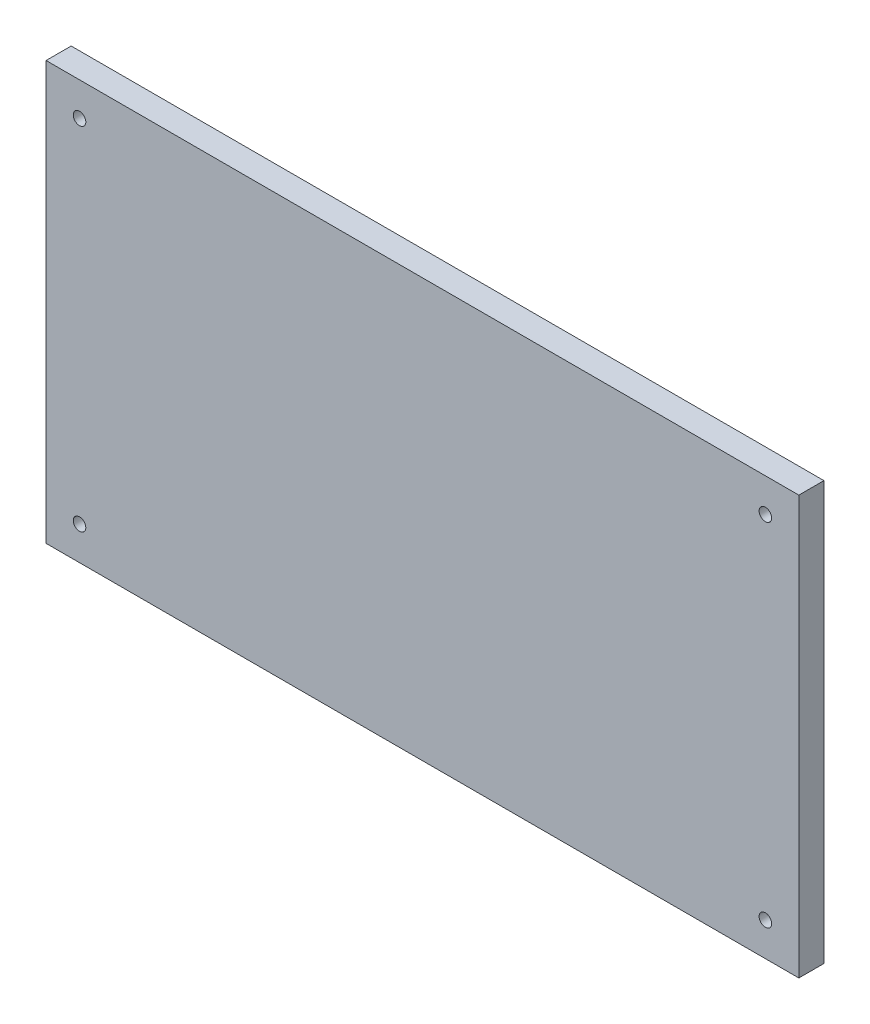
from build123d import *

# Parameters (mm, degrees)
SKETCH1_W           = 450
SKETCH1_H           = 250
BOSS_EXTRUDE1_DEPTH = 15
SKETCH4_R           = 3.75
CUT_EXTRUDE1_DEPTH  = 65


with BuildPart() as part:
    # Sketch1 → Boss-Extrude1 (new body)
    with BuildSketch(Plane.XY):
        with Locations((-45.432692308, 24.399038462)):
            Rectangle(SKETCH1_W, SKETCH1_H)
    extrude(amount=BOSS_EXTRUDE1_DEPTH)

    # Sketch4 → Cut-Extrude1 (cut)
    with BuildSketch(Plane.XY):
        with Locations((159.567307692, 129.399038462)):
            Circle(SKETCH4_R)
        with Locations((159.567307692, -80.600961538)):
            Circle(SKETCH4_R)
        with Locations((-250.432692308, -80.600961538)):
            Circle(SKETCH4_R)
        with Locations((-250.432692308, 129.399038462)):
            Circle(SKETCH4_R)
    extrude(amount=CUT_EXTRUDE1_DEPTH, mode=Mode.SUBTRACT)


solid = part.part
